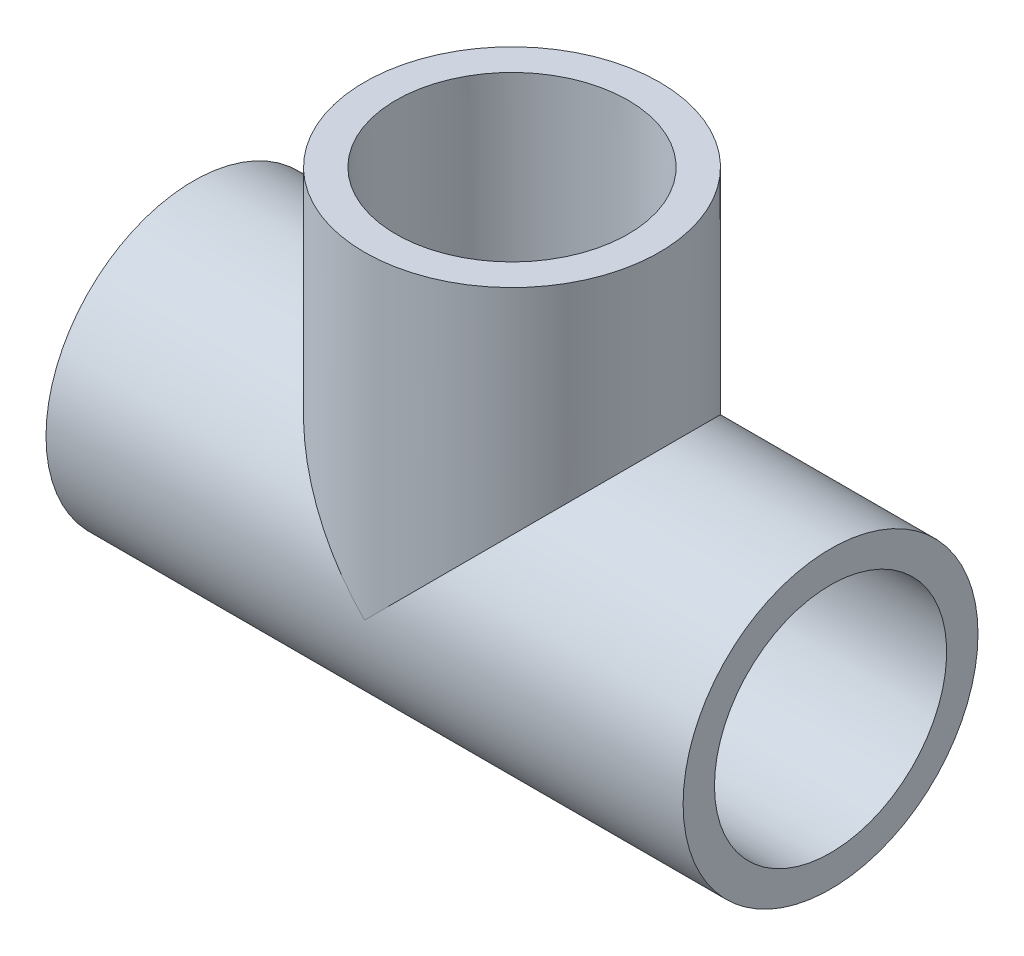
from build123d import *
from build123d.topology import SkipClean

# Parameters (mm, degrees)
BOSS_EXTRUDE1_START     = 34.9504
BOSS_EXTRUDE1_DEPTH     = 34.9504
BOSS_EXTRUDE2_DEPTH     = 17.4752001
SKETCH5_R               = 12.1539
CUT_EXTRUDE1_DEPTH      = 34.9504
CUT_EXTRUDE2_REACH      = 66.019
CUT_EXTRUDE2_END_RADIUS = 12.1539
SKETCH6_R               = 12.1539


# Read off the part's stored shape, not the designer's step: Boss-Extrude2
with BuildPart() as part:
    # Sketch1 → Revolve1 (revolve)
    with BuildSketch(Plane.XY, mode=Mode.PRIVATE) as revolve1_sk:
        Polygon((-46.1772, -21.3741), (-17.4752, -21.3741), (-17.4752, -16.637), (-46.1772, -16.8275), align=None)
    revolve(revolve1_sk.sketch.rotate(Axis((-46.1772, 0, 0), (1, 0, 0)), 270), axis=Axis((-46.1772, 0, 0), (1, 0, 0)))


with BuildPart() as body_2:
    # Mirror1: mirrored copy
    add(part.part.mirror(Plane(origin=(0, 0, 0), x_dir=(0, 0, 1), z_dir=(1, 0, 0))))


with BuildPart() as body_3:
    # Sketch2 → Revolve2 (revolve)
    with BuildSketch(Plane.XY, mode=Mode.PRIVATE) as revolve2_sk:
        Polygon((16.8275, 46.1772), (16.637, 17.4752), (21.3741, 17.4752), (21.3741, 46.1772), align=None)
    revolve(revolve2_sk.sketch.rotate(Axis((0, 0, 0), (0, 1, 0)), 90), axis=Axis((0, 0, 0), (0, 1, 0)))


with BuildPart() as part_1:
    with SkipClean():  # the faces are left unmerged after this step: merging them gives an invalid solid
        add(part.part)

        add(body_2.part)  # Boss-Extrude1 merges body 2

        add(body_3.part)  # Boss-Extrude1 merges body 3
        # Sketch3 → Boss-Extrude1 (add)
        with BuildSketch(Plane(origin=(-17.4752, 0, 0), x_dir=(0, 0, -1), z_dir=(1, 0, 0)).offset(BOSS_EXTRUDE1_START)):
            with BuildLine():
                Line((12.307296038, 17.4752), (-12.307296038, 17.4752))
                ThreePointArc((-12.307296038, 17.4752), (0, -21.3741), (12.307296038, 17.4752))
            make_face()
        extrude(amount=-BOSS_EXTRUDE1_DEPTH)

    # Boss-Extrude2 outline → Boss-Extrude2 (add)
    with SkipClean():  # the faces are left unmerged after this step: merging them gives an invalid solid
        with BuildSketch(Plane.XZ.offset(-17.4752)):
            with BuildLine():
                ThreePointArc((-17.4752, -12.307296038), (0, -21.3741), (17.4752, -12.307296038))
                Line((17.4752, -12.307296038), (17.4752, 12.307296038))
                ThreePointArc((17.4752, 12.307296038), (0, 21.3741), (-17.4752, 12.307296038))
                Line((-17.4752, 12.307296038), (-17.4752, -12.307296038))
            make_face()
        extrude(amount=BOSS_EXTRUDE2_DEPTH)

    # Sketch5 → Cut-Extrude1 (cut)
    with SkipClean():  # the faces are left unmerged after this step: merging them gives an invalid solid
        with BuildSketch(Plane.ZY.offset(17.4752)):
            Circle(SKETCH5_R)
        extrude(amount=-CUT_EXTRUDE1_DEPTH, mode=Mode.SUBTRACT)

    # Cut-Extrude2: up to this cylinder (the profile starts outside it)
    with SkipClean():  # the faces are left unmerged after this step: merging them gives an invalid solid
        cut_extrude2_end = Plane(origin=(0, 0, 0), z_dir=(-1, 0, 0)) * Cylinder(CUT_EXTRUDE2_END_RADIUS, 157.3458, mode=Mode.PRIVATE)
        # Sketch6 → Cut-Extrude2 (cut, up to the surface)
        with BuildSketch(Plane(origin=(0, 17.4752, 0), x_dir=(1, 0, 0), z_dir=(0, 1, 0)), mode=Mode.PRIVATE) as cut_extrude2_sk1:
            with Locations(Location((0, 0, 0), (0, 0, 270))):
                Circle(SKETCH6_R)
        cut_extrude2_tool1 = extrude(cut_extrude2_sk1.sketch, amount=-CUT_EXTRUDE2_REACH, mode=Mode.PRIVATE) - cut_extrude2_end
        add(cut_extrude2_tool1.solids().sort_by_distance((0, 17.4752, 0))[0], mode=Mode.SUBTRACT)


solid = part_1.part
